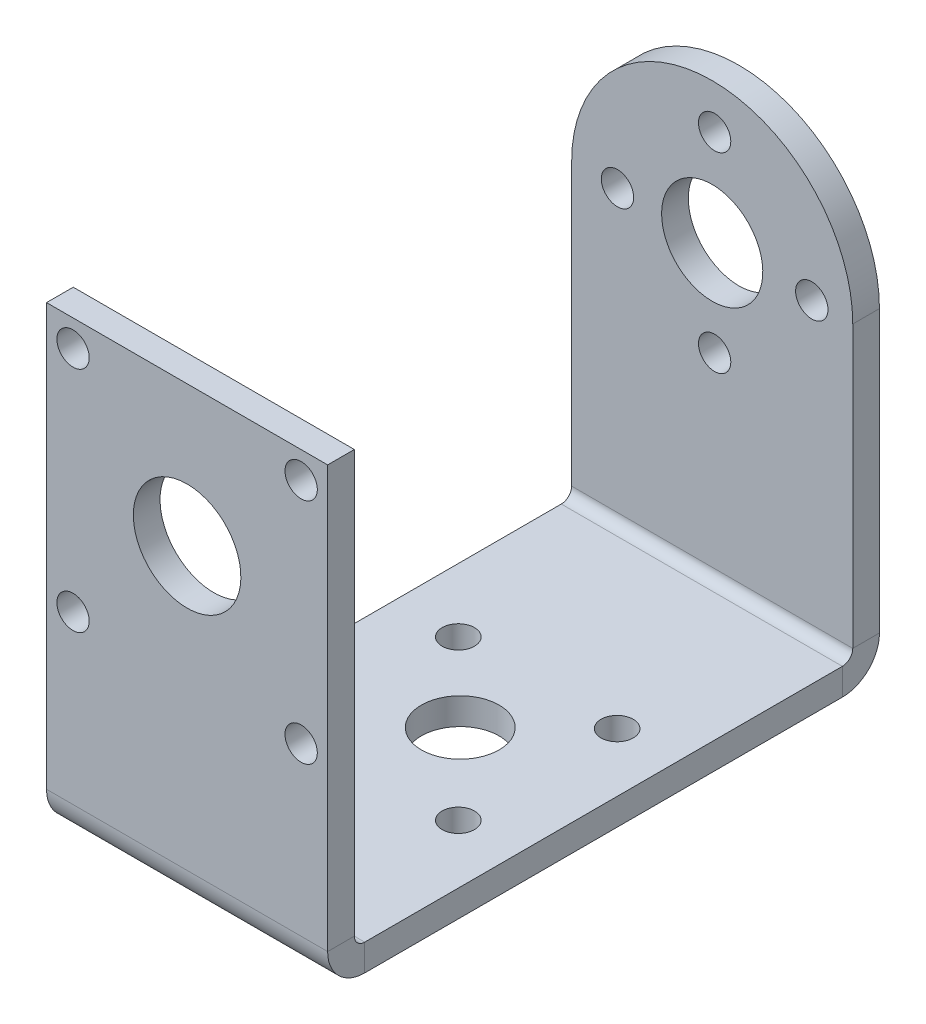
from build123d import *

# Parameters (mm, degrees)
SKETCH2_R                    = 3.600024351
SKETCH2_R_2                  = 1.15
SKETCH2_R_3                  = 2.765
SKETCH2_R_4                  = 3.825
BASE_FLANGE1_DEPTH           = 1.9
SKETCHED_START               = -46
SKETCHED_BEND2_OUTLINE_W     = 20
SKETCHED_BEND2_OUTLINE_H     = 1.9
SKETCHED_BEND2_DEPTH         = 31.31094649
SKETCHED_START_2             = 24.571706037
SKETCHED_BEND2_2_OUTLINE_W   = 20
SKETCHED_BEND2_2_OUTLINE_H   = 1.9
SKETCHED_BEND2_2_DEPTH       = 30
SKETCHED_START_3             = 22.671706037
SKETCHED_BEND2_3_OUTLINE_W   = 20
SKETCHED_BEND2_3_OUTLINE_H   = 30.723894915
SKETCHED_BEND2_3_OUTLINE_R   = 1.15
SKETCHED_BEND2_3_OUTLINE_R_2 = 3.825
SKETCHED_BEND2_3_DEPTH       = 1.643564284
SKETCHED_START_4             = -14.432617794
SKETCHED_BEND2_4_OUTLINE_R   = 1.15
SKETCHED_BEND2_4_OUTLINE_R_2 = 3.600024351
SKETCHED_BEND2_4_DEPTH       = 1.643564284
SKETCHED_START_5             = 24.300821753
SKETCHED_BEND2_5_OUTLINE_R   = 1.15
SKETCHED_BEND2_5_DEPTH       = 0.270884284
SKETCHED_START_6             = -14.68905351
SKETCHED_BEND2_6_OUTLINE_R   = 3.825
SKETCHED_BEND2_6_OUTLINE_R_2 = 3.600024351
SKETCHED_BEND2_6_OUTLINE_R_3 = 1.15
SKETCHED_BEND2_6_DEPTH       = 0.270884284
SKETCHED_BEND2_7_OUTLINE_R   = 1.15
SKETCHED_BEND2_7_OUTLINE_R_2 = 3.825
SKETCHED_BEND2_7_DEPTH       = 2.6366
SKETCHED_START_7             = 21.935106037
SKETCHED_BEND2_8_OUTLINE_R   = 1.15
SKETCHED_BEND2_8_OUTLINE_R_2 = 3.825
SKETCHED_BEND2_8_DEPTH       = 2.6366
SKETCHED_START_8             = -21
SKETCHED_BEND2_9_DEPTH       = 22


with BuildPart() as part:
    # Base-Flange1: sheet metal written as solids
    # Sketch2 → Base-Flange1 (new body)
    with BuildSketch(Plane(origin=(0, 0, 0), x_dir=(1, 0, 0), z_dir=(0, 1, 0))):
        with BuildLine():
            Line((0.004810112, 34.68905351), (0.004810112, -54.571706037))
            Line((0.004810112, -54.571706037), (-19.995189888, -54.571706037))
            Line((-19.995189888, -54.571706037), (-19.995189888, 34.68905351))
            ThreePointArc((-19.995189888, 34.68905351), (-9.995189888, 44.68905351), (0.004810112, 34.68905351))
        make_face()
        with Locations(Location((-9.995189888, 34.68905351, 0), (0, 0, 270))):
            Circle(SKETCH2_R, mode=Mode.SUBTRACT)
        with Locations(Location((-16.734816292, 34.68905351, 0), (0, 0, 270))):
            Circle(SKETCH2_R_2, mode=Mode.SUBTRACT)
        with Locations(Location((-2.909816292, 34.68905351, 0), (0, 0, 270))):
            Circle(SKETCH2_R_2, mode=Mode.SUBTRACT)
        with Locations(Location((-9.822316292, 41.60155351, 0), (0, 0, 270))):
            Circle(SKETCH2_R_2, mode=Mode.SUBTRACT)
        with Locations(Location((-9.822316292, 27.999029159, 0), (0, 0, 270))):
            Circle(SKETCH2_R_2, mode=Mode.SUBTRACT)
        with Locations(Location((-9.822316292, -5.31094649, 0), (0, 0, 270))):
            Circle(SKETCH2_R_3, mode=Mode.SUBTRACT)
        with Locations(Location((-15.472316292, 0.201962686, 0), (0, 0, 270))):
            Circle(SKETCH2_R_2, mode=Mode.SUBTRACT)
        with Locations(Location((-4.172316292, 0.201962686, 0), (0, 0, 270))):
            Circle(SKETCH2_R_2, mode=Mode.SUBTRACT)
        with Locations(Location((-15.472316292, -11.098037314, 0), (0, 0, 270))):
            Circle(SKETCH2_R_2, mode=Mode.SUBTRACT)
        with Locations(Location((-4.172316292, -11.098037314, 0), (0, 0, 270))):
            Circle(SKETCH2_R_2, mode=Mode.SUBTRACT)
        with Locations(Location((-9.995189888, -44.571706037, 0), (0, 0, 270))):
            Circle(SKETCH2_R_4, mode=Mode.SUBTRACT)
        with Locations(Location((-1.880189888, -52.686706037, 0), (0, 0, 270))):
            Circle(SKETCH2_R_2, mode=Mode.SUBTRACT)
        with Locations(Location((-18.110189888, -52.686706037, 0), (0, 0, 270))):
            Circle(SKETCH2_R_2, mode=Mode.SUBTRACT)
        with Locations(Location((-1.880189888, -36.456706037, 0), (0, 0, 270))):
            Circle(SKETCH2_R_2, mode=Mode.SUBTRACT)
        with Locations(Location((-18.110189888, -36.456706037, 0), (0, 0, 270))):
            Circle(SKETCH2_R_2, mode=Mode.SUBTRACT)
    extrude(amount=-BASE_FLANGE1_DEPTH)

    # Sketched Bend2: read off the stored shape, not the designer's step
    # Sketched Bend2 outline → Sketched Bend2 (cut)
    with BuildSketch(Plane.XY.offset(SKETCHED_START)):
        with Locations((-9.995189888, -0.95)):
            Rectangle(SKETCHED_BEND2_OUTLINE_W, SKETCHED_BEND2_OUTLINE_H)
    extrude(amount=SKETCHED_BEND2_DEPTH, mode=Mode.SUBTRACT)

    # Sketched Bend2 2 outline → Sketched Bend2 2 (cut)
    with BuildSketch(Plane.XY.offset(SKETCHED_START_2)):
        with Locations((-9.995189888, -0.95)):
            Rectangle(SKETCHED_BEND2_2_OUTLINE_W, SKETCHED_BEND2_2_OUTLINE_H)
    extrude(amount=SKETCHED_BEND2_2_DEPTH, mode=Mode.SUBTRACT)

    # Sketched Bend2 3 outline → Sketched Bend2 3 (add)
    with BuildSketch(Plane.XY.offset(SKETCHED_START_3)):
        with Locations((-9.995189888, 15.361947458)):
            Rectangle(SKETCHED_BEND2_3_OUTLINE_W, SKETCHED_BEND2_3_OUTLINE_H)
        with Locations((-18.110189888, 12.608894915)):
            Circle(SKETCHED_BEND2_3_OUTLINE_R, mode=Mode.SUBTRACT)
        with Locations((-1.880189888, 12.608894915)):
            Circle(SKETCHED_BEND2_3_OUTLINE_R, mode=Mode.SUBTRACT)
        with Locations((-9.995189888, 20.723894915)):
            Circle(SKETCHED_BEND2_3_OUTLINE_R_2, mode=Mode.SUBTRACT)
        with Locations((-18.110189888, 28.838894915)):
            Circle(SKETCHED_BEND2_3_OUTLINE_R, mode=Mode.SUBTRACT)
        with Locations((-1.880189888, 28.838894915)):
            Circle(SKETCHED_BEND2_3_OUTLINE_R, mode=Mode.SUBTRACT)
    extrude(amount=SKETCHED_BEND2_3_DEPTH)

    # Sketched Bend2 4 outline → Sketched Bend2 4 (add)
    with BuildSketch(Plane.XY.offset(SKETCHED_START_4)):
        with BuildLine():
            Line((-19.995189888, 20.723894915), (-19.995189888, 0))
            Line((-19.995189888, 0), (0.004810112, 0))
            Line((0.004810112, 0), (0.004810112, 20.723894915))
            ThreePointArc((0.004810112, 20.723894915), (-9.995189888, 30.723894915), (-19.995189888, 20.723894915))
        make_face()
        with Locations((-9.822316292, 14.033870564)):
            Circle(SKETCHED_BEND2_4_OUTLINE_R, mode=Mode.SUBTRACT)
        with Locations((-16.734816292, 20.723894915)):
            Circle(SKETCHED_BEND2_4_OUTLINE_R, mode=Mode.SUBTRACT)
        with Locations((-2.909816292, 20.723894915)):
            Circle(SKETCHED_BEND2_4_OUTLINE_R, mode=Mode.SUBTRACT)
        with Locations((-9.822316292, 27.636394915)):
            Circle(SKETCHED_BEND2_4_OUTLINE_R, mode=Mode.SUBTRACT)
        with Locations((-9.995189888, 20.723894915)):
            Circle(SKETCHED_BEND2_4_OUTLINE_R_2, mode=Mode.SUBTRACT)
    extrude(amount=SKETCHED_BEND2_4_DEPTH)

    # Sketched Bend2 5 outline → Sketched Bend2 5 (add)
    # profile 1 of 6: a face of its own
    with BuildSketch(Plane.XY.offset(SKETCHED_START_5)):
        with BuildLine():
            Line((-19.995189888, 30.723894915), (-19.995189888, 20.723894915))
            ThreePointArc((-19.995189888, 20.723894915), (-17.0662577, 27.794962727), (-9.995189888, 30.723894915))
            Line((-9.995189888, 30.723894915), (-19.995189888, 30.723894915))
        make_face()
        with Locations((-18.110189888, 28.838894915)):
            Circle(SKETCHED_BEND2_5_OUTLINE_R, mode=Mode.SUBTRACT)
    # profile 2 of 6: a face of its own
    with BuildSketch(Plane.XY.offset(SKETCHED_START_5)):
        with BuildLine():
            Line((0.004810112, 30.723894915), (-9.995189888, 30.723894915))
            ThreePointArc((-9.995189888, 30.723894915), (-2.924122076, 27.794962727), (0.004810112, 20.723894915))
            Line((0.004810112, 20.723894915), (0.004810112, 30.723894915))
        make_face()
        with Locations((-1.880189888, 28.838894915)):
            Circle(SKETCHED_BEND2_5_OUTLINE_R, mode=Mode.SUBTRACT)
    # profile 3 of 6: a face of its own
    with BuildSketch(Plane.XY.offset(SKETCHED_START_5)):
        with Locations((-9.822316292, 14.033870564)):
            Circle(SKETCHED_BEND2_5_OUTLINE_R)
    # profile 4 of 6: a face of its own
    with BuildSketch(Plane.XY.offset(SKETCHED_START_5)):
        with Locations((-9.822316292, 27.636394915)):
            Circle(SKETCHED_BEND2_5_OUTLINE_R)
    # profile 5 of 6: a face of its own
    with BuildSketch(Plane.XY.offset(SKETCHED_START_5)):
        with Locations((-2.909816292, 20.723894915)):
            Circle(SKETCHED_BEND2_5_OUTLINE_R)
    # profile 6 of 6: a face of its own
    with BuildSketch(Plane.XY.offset(SKETCHED_START_5)):
        with Locations((-16.734816292, 20.723894915)):
            Circle(SKETCHED_BEND2_5_OUTLINE_R)
    extrude(amount=SKETCHED_BEND2_5_DEPTH)

    # Sketched Bend2 6 outline → Sketched Bend2 6 (add)
    # profile 1 of 3: a face of its own
    with BuildSketch(Plane.XY.offset(SKETCHED_START_6)):
        with Locations((-9.995189888, 20.723894915)):
            Circle(SKETCHED_BEND2_6_OUTLINE_R)
        with Locations((-9.995189888, 20.723894915)):
            Circle(SKETCHED_BEND2_6_OUTLINE_R_2, mode=Mode.SUBTRACT)
    # profile 2 of 3: a face of its own
    with BuildSketch(Plane.XY.offset(SKETCHED_START_6)):
        with Locations((-1.880189888, 12.608894915)):
            Circle(SKETCHED_BEND2_6_OUTLINE_R_3)
    # profile 3 of 3: a face of its own
    with BuildSketch(Plane.XY.offset(SKETCHED_START_6)):
        with Locations((-18.110189888, 12.608894915)):
            Circle(SKETCHED_BEND2_6_OUTLINE_R_3)
    extrude(amount=SKETCHED_BEND2_6_DEPTH)

    # Sketched Bend2 7 outline → Sketched Bend2 7 (add)
    with BuildSketch(Plane.XY.offset(SKETCHED_START_6)):
        with BuildLine():
            ThreePointArc((0.004810112, 20.723894915), (-9.995189888, 30.723894915), (-19.995189888, 20.723894915))
            Line((-19.995189888, 20.723894915), (-19.995189888, 0))
            Line((-19.995189888, 0), (0.004810112, 0))
            Line((0.004810112, 0), (0.004810112, 20.723894915))
        make_face()
        with Locations((-18.110189888, 12.608894915)):
            Circle(SKETCHED_BEND2_7_OUTLINE_R, mode=Mode.SUBTRACT)
        with Locations((-9.822316292, 14.033870564)):
            Circle(SKETCHED_BEND2_7_OUTLINE_R, mode=Mode.SUBTRACT)
        with Locations((-1.880189888, 12.608894915)):
            Circle(SKETCHED_BEND2_7_OUTLINE_R, mode=Mode.SUBTRACT)
        with Locations((-16.734816292, 20.723894915)):
            Circle(SKETCHED_BEND2_7_OUTLINE_R, mode=Mode.SUBTRACT)
        with Locations((-9.995189888, 20.723894915)):
            Circle(SKETCHED_BEND2_7_OUTLINE_R_2, mode=Mode.SUBTRACT)
        with Locations((-2.909816292, 20.723894915)):
            Circle(SKETCHED_BEND2_7_OUTLINE_R, mode=Mode.SUBTRACT)
        with Locations((-9.822316292, 27.636394915)):
            Circle(SKETCHED_BEND2_7_OUTLINE_R, mode=Mode.SUBTRACT)
    extrude(amount=SKETCHED_BEND2_7_DEPTH)

    # Sketched Bend2 8 outline → Sketched Bend2 8 (add)
    with BuildSketch(Plane.XY.offset(SKETCHED_START_7)):
        with BuildLine():
            ThreePointArc((0.004810112, 20.723894915), (-9.995189888, 30.723894915), (-19.995189888, 20.723894915))
            Line((-19.995189888, 20.723894915), (-19.995189888, 0))
            Line((-19.995189888, 0), (0.004810112, 0))
            Line((0.004810112, 0), (0.004810112, 20.723894915))
        make_face()
        with Locations((-18.110189888, 12.608894915)):
            Circle(SKETCHED_BEND2_8_OUTLINE_R, mode=Mode.SUBTRACT)
        with Locations((-9.822316292, 14.033870564)):
            Circle(SKETCHED_BEND2_8_OUTLINE_R, mode=Mode.SUBTRACT)
        with Locations((-1.880189888, 12.608894915)):
            Circle(SKETCHED_BEND2_8_OUTLINE_R, mode=Mode.SUBTRACT)
        with Locations((-16.734816292, 20.723894915)):
            Circle(SKETCHED_BEND2_8_OUTLINE_R, mode=Mode.SUBTRACT)
        with Locations((-9.995189888, 20.723894915)):
            Circle(SKETCHED_BEND2_8_OUTLINE_R_2, mode=Mode.SUBTRACT)
        with Locations((-2.909816292, 20.723894915)):
            Circle(SKETCHED_BEND2_8_OUTLINE_R, mode=Mode.SUBTRACT)
        with Locations((-9.822316292, 27.636394915)):
            Circle(SKETCHED_BEND2_8_OUTLINE_R, mode=Mode.SUBTRACT)
    extrude(amount=SKETCHED_BEND2_8_DEPTH)

    # Sketched Bend2 9 outline → Sketched Bend2 9 (cut)
    with BuildSketch(Plane.YZ.offset(SKETCHED_START_8)):
        with BuildLine():
            ThreePointArc((0.7366, -14.68905351), (-1.127757739, -13.916811249), (-1.9, -12.05245351))
            Line((-1.9, -12.05245351), (-1.900000014, -16))
            Line((-1.900000014, -16), (32, -16))
            Line((32, -16), (32, -14.689053521))
            Line((32, -14.689053521), (0.7366, -14.68905351))
        make_face()
        with BuildLine():
            Line((-1.900000014, 26), (-1.9, 21.935106037))
            ThreePointArc((-1.9, 21.935106037), (-1.127757739, 23.799463776), (0.7366, 24.571706037))
            Line((0.7366, 24.571706037), (32, 24.571706048))
            Line((32, 24.571706048), (32, 26))
            Line((32, 26), (-1.900000014, 26))
        make_face()
        with BuildLine():
            Line((0.7366, -12.78905351), (32, -12.78905351))
            Line((32, -12.78905351), (32, -12.05245351))
            Line((32, -12.05245351), (0, -12.05245351))
            ThreePointArc((0, -12.05245351), (0.215745145, -12.573308365), (0.7366, -12.78905351))
        make_face()
        with BuildLine():
            Line((32, 21.935106037), (32, 22.671706037))
            Line((32, 22.671706037), (0.7366, 22.671706037))
            ThreePointArc((0.7366, 22.671706037), (0.215745145, 22.455960892), (0, 21.935106037))
            Line((0, 21.935106037), (32, 21.935106037))
        make_face()
    extrude(amount=SKETCHED_BEND2_9_DEPTH, mode=Mode.SUBTRACT)


solid = part.part
